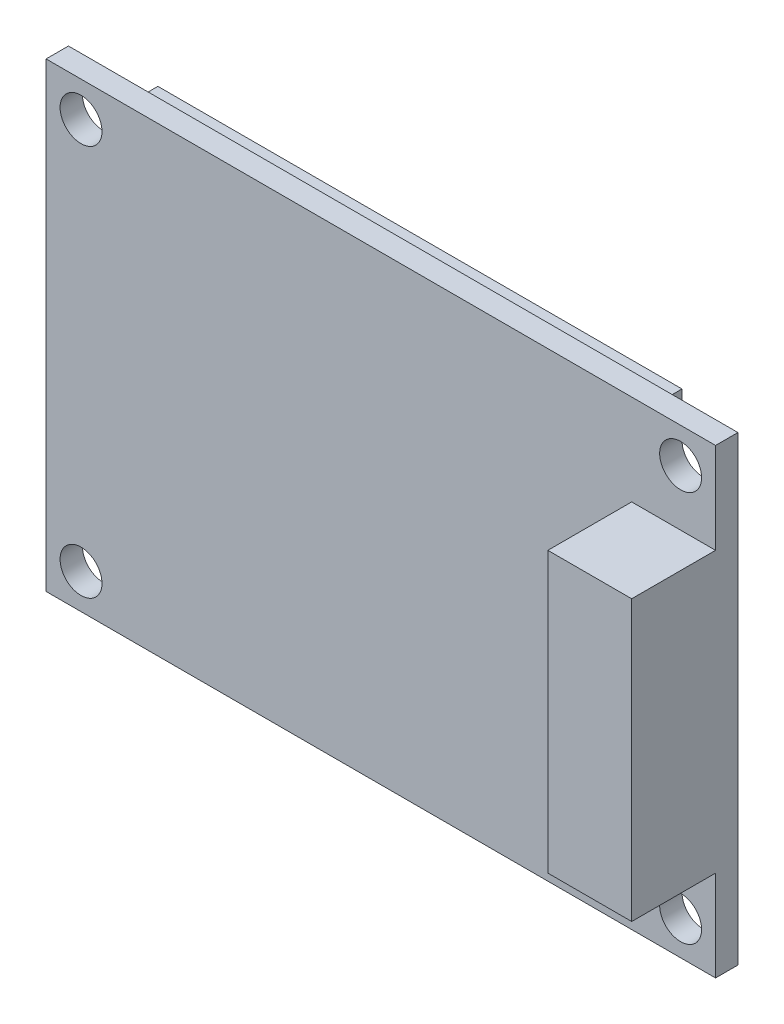
from build123d import *

# Parameters (mm, degrees)
BASE_PCB_2_W              = 47.9
BASE_PCB_2_H              = 33
BASE_PCB_2_R              = 1.5
BASE_PCB_DEPTH            = 1.6
ESQUISSE4_W               = 37.5
ESQUISSE4_H               = 32
E_INK_DISPLAY_DEPTH       = 1.2
ESQUISSE5_W               = 27.6
ESQUISSE5_H               = 27.6
DISPLAY_200_200_DEPTH     = 0.5
ESQUISSE6_W               = 6
ESQUISSE6_H               = 20
CONNECTEUR_8BROCHES_DEPTH = 6


with BuildPart() as part:
    # BASE PCB 2 → Base_PCB (new body)
    with BuildSketch(Plane.XY):
        Rectangle(BASE_PCB_2_W, BASE_PCB_2_H)
        with Locations((-21.45, 14)):
            Circle(BASE_PCB_2_R, mode=Mode.SUBTRACT)
        with Locations((-21.45, -14)):
            Circle(BASE_PCB_2_R, mode=Mode.SUBTRACT)
        with Locations((21.45, -14)):
            Circle(BASE_PCB_2_R, mode=Mode.SUBTRACT)
        with Locations((21.45, 14)):
            Circle(BASE_PCB_2_R, mode=Mode.SUBTRACT)
    extrude(amount=BASE_PCB_DEPTH)

    # Esquisse4 → E-Ink_display (add)
    with BuildSketch(Plane.XY):
        Rectangle(ESQUISSE4_W, ESQUISSE4_H)
    extrude(amount=-E_INK_DISPLAY_DEPTH)

    # Esquisse5 → Display_200*200 (cut)
    with BuildSketch(Plane(origin=(0, 0, -1.2), x_dir=(-1, 0, 0), z_dir=(0, 0, -1))):
        with Locations((-2.95, 0)):
            Rectangle(ESQUISSE5_W, ESQUISSE5_H)
    extrude(amount=-DISPLAY_200_200_DEPTH, mode=Mode.SUBTRACT)

    # Esquisse6 → Connecteur_8broches (add)
    with BuildSketch(Plane.XY.offset(1.6)):
        with Locations((20.95, 0)):
            Rectangle(ESQUISSE6_W, ESQUISSE6_H)
    extrude(amount=CONNECTEUR_8BROCHES_DEPTH)


solid = part.part
